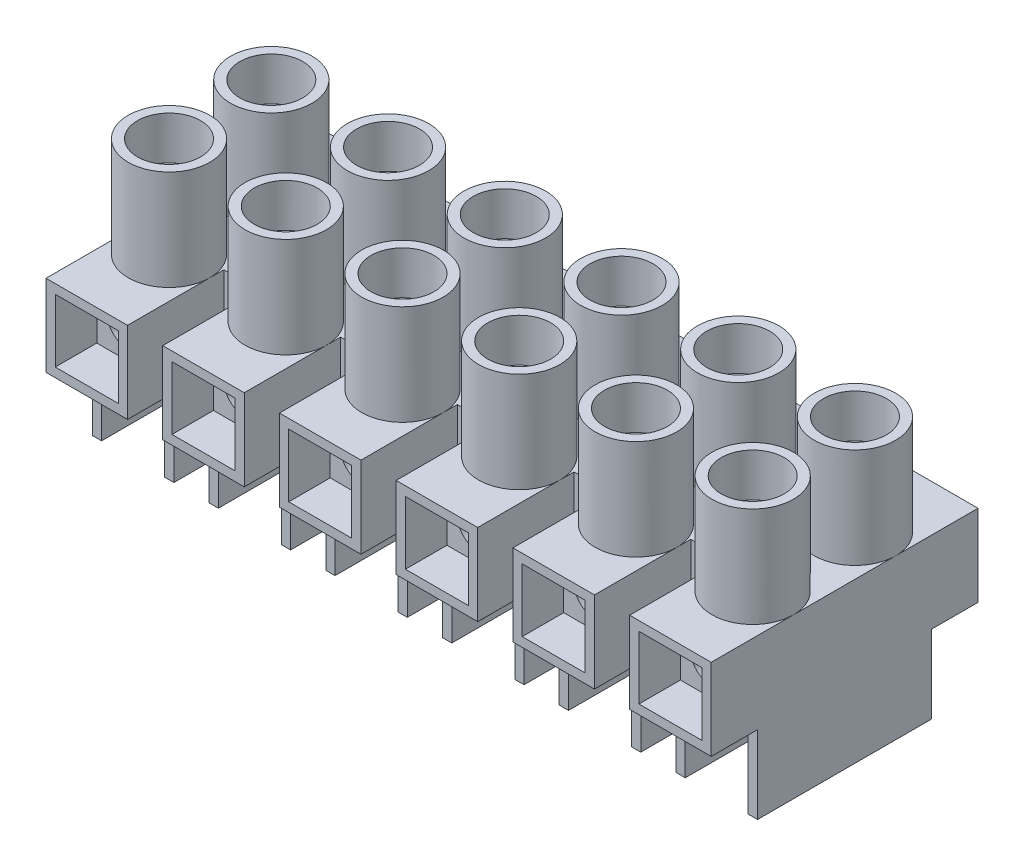
from build123d import *

# Parameters (mm, degrees)
SKETCH1_W           = 5.588
SKETCH1_H           = 5.588
BOSS_EXTRUDE1_DEPTH = 9.144
SKETCH2_R           = 2.794
BOSS_EXTRUDE2_DEPTH = 6.858
SHELL1_START        = 0.635
SHELL1_OUTLINE_R    = 2.159
SHELL1_DEPTH        = 11.811
SHELL1_2_DEPTH      = 4.318
SKETCH3_W           = 5.588
SKETCH3_H           = 5.969
BOSS_EXTRUDE3_DEPTH = 5.334
SHELL2_START        = -5.334
SHELL2_OUTLINE_W    = 4.318
SHELL2_OUTLINE_H    = 5.969
SHELL2_DEPTH        = 5.334
LPATTERN1_COUNT     = 6
LPATTERN1_PITCH     = 8.001
SKETCH5_W           = 2.413
SKETCH5_H           = 2.54
BOSS_EXTRUDE4_DEPTH = 5.588
CUT_EXTRUDE1_START  = -49.137691064
SKETCH7_R           = 1.4986
CUT_EXTRUDE1_DEPTH  = 54.725691064
LPATTERN2_COUNT     = 5
LPATTERN2_PITCH     = 8.001
LPATTERN2_2_COUNT   = 5
LPATTERN2_2_PITCH   = 8.001
SKETCH8_W           = 4.2164
SKETCH8_H           = 4.2164
SKETCH8_R           = 1.397
BOSS_EXTRUDE5_DEPTH = 6.35
LPATTERN3_COUNT     = 6
LPATTERN3_PITCH     = 8.001
SKETCH9_R           = 1.5875
BOSS_EXTRUDE6_DEPTH = 1.524
BOSS_EXTRUDE6_DRAFT = -15
SKETCH10_W          = 3.991709138
SKETCH10_H          = 0.508
CUT_EXTRUDE2_DEPTH  = 0.508
SKETCH11_R          = 1.143
BOSS_EXTRUDE7_DEPTH = 3.81
LPATTERN4_COUNT     = 6
LPATTERN4_PITCH     = 8.001
LPATTERN4_2_COUNT   = 2
LPATTERN4_2_PITCH   = 7.0104


# Read off the part's stored shape, not the designer's step: Shell1, Shell2
with BuildPart() as part:
    # Sketch1 → Boss-Extrude1 (new body)
    with BuildSketch(Plane.XY):
        with Locations((2.794, 2.794)):
            Rectangle(SKETCH1_W, SKETCH1_H)
    extrude(amount=BOSS_EXTRUDE1_DEPTH)

    # Sketch2 → Boss-Extrude2 (add)
    with BuildSketch(Plane(origin=(0, 5.588, 0), x_dir=(1, 0, 0), z_dir=(0, 1, 0))):
        with Locations(Location((2.794, -3.5052, 0), (0, 0, 180))):
            Circle(SKETCH2_R)
    extrude(amount=BOSS_EXTRUDE2_DEPTH)

    # Shell1 outline → Shell1 (cut)
    with BuildSketch(Plane(origin=(0, 0, 0), x_dir=(1, 0, 0), z_dir=(0, 1, 0)).offset(SHELL1_START)):
        with Locations((2.794, -3.5052)):
            Circle(SHELL1_OUTLINE_R)
    extrude(amount=SHELL1_DEPTH, mode=Mode.SUBTRACT)

    # Shell1 2 outline → Shell1 2 (cut)
    with BuildSketch(Plane(origin=(0, 0, 0), x_dir=(1, 0, 0), z_dir=(0, 1, 0)).offset(SHELL1_START)):
        with BuildLine():
            Line((0.635, -3.5052), (0.635, -9.144))
            Line((0.635, -9.144), (4.953, -9.144))
            Line((4.953, -9.144), (4.953, -3.5052))
            ThreePointArc((4.953, -3.5052), (2.794, -5.6642), (0.635, -3.5052))
        make_face()
        with BuildLine():
            Line((0.635, 0), (0.635, -3.5052))
            ThreePointArc((0.635, -3.5052), (2.794, -1.3462), (4.953, -3.5052))
            Line((4.953, -3.5052), (4.953, 0))
            Line((4.953, 0), (0.635, 0))
        make_face()
    extrude(amount=SHELL1_2_DEPTH, mode=Mode.SUBTRACT)

    # Sketch3 → Boss-Extrude3 (add)
    with BuildSketch(Plane.XZ):
        with Locations((2.794, 2.9845)):
            Rectangle(SKETCH3_W, SKETCH3_H)
    extrude(amount=BOSS_EXTRUDE3_DEPTH)

    # Shell2 outline → Shell2 (cut)
    with BuildSketch(Plane(origin=(0, 0, 0), x_dir=(1, 0, 0), z_dir=(0, 1, 0)).offset(SHELL2_START)):
        with Locations((2.794, -2.9845)):
            Rectangle(SHELL2_OUTLINE_W, SHELL2_OUTLINE_H)
    extrude(amount=SHELL2_DEPTH, mode=Mode.SUBTRACT)


with BuildPart() as lpattern1_1:
    # LPattern1: pattern copy
    add(part.part.moved(Location(Vector(1, 0, 0) * (1 * LPATTERN1_PITCH))))


with BuildPart() as lpattern1_2:
    # LPattern1: pattern copy
    add(part.part.moved(Location(Vector(1, 0, 0) * (2 * LPATTERN1_PITCH))))


with BuildPart() as lpattern1_3:
    # LPattern1: pattern copy
    add(part.part.moved(Location(Vector(1, 0, 0) * (3 * LPATTERN1_PITCH))))


with BuildPart() as lpattern1_4:
    # LPattern1: pattern copy
    add(part.part.moved(Location(Vector(1, 0, 0) * (4 * LPATTERN1_PITCH))))


with BuildPart() as lpattern1_5:
    # LPattern1: pattern copy
    add(part.part.moved(Location(Vector(1, 0, 0) * (5 * LPATTERN1_PITCH))))


with BuildPart() as part_1:
    add(part.part)

    add(lpattern1_1.part)  # Boss-Extrude4 merges LPattern1_1
    # Sketch5 → Boss-Extrude4 (add)
    with BuildSketch(Plane(origin=(0, 0, 0), x_dir=(1, 0, 0), z_dir=(0, 1, 0))):
        with Locations((6.7945, -1.27)):
            Rectangle(SKETCH5_W, SKETCH5_H)
    boss_extrude4 = extrude(amount=BOSS_EXTRUDE4_DEPTH)

    # Sketch7 → Cut-Extrude1 (cut)
    with BuildSketch(Plane(origin=(0, 0, 0), x_dir=(1, 0, 0), z_dir=(0, 1, 0)).offset(CUT_EXTRUDE1_START)):
        with Locations((6.7945, 0)):
            Circle(SKETCH7_R)
    cut_extrude1 = extrude(amount=CUT_EXTRUDE1_DEPTH, mode=Mode.SUBTRACT)

    add(lpattern1_2.part)  # LPattern2 merges LPattern1_2

    add(lpattern1_3.part)  # LPattern2 merges LPattern1_3

    add(lpattern1_4.part)  # LPattern2 merges LPattern1_4

    add(lpattern1_5.part)  # LPattern2 merges LPattern1_5
    # LPattern2: Boss-Extrude4 ×5
    with Locations(*[(i * LPATTERN2_PITCH, 0, 0) for i in range(1, LPATTERN2_COUNT)]):
        add(boss_extrude4)

    # LPattern2 2: Cut-Extrude1 ×5
    with Locations(*[(i * LPATTERN2_2_PITCH, 0, 0) for i in range(1, LPATTERN2_2_COUNT)]):
        add(cut_extrude1, mode=Mode.SUBTRACT)

    # Mirror1: part across plane


with BuildPart() as part_2:
    add(part_1.part)
    add(part_1.part.mirror(Plane.XY))


with BuildPart() as body_2:
    # Sketch8 → Boss-Extrude5 (new body)
    with BuildSketch(Plane.XY):
        with Locations((2.794, 2.794)):
            Rectangle(SKETCH8_W, SKETCH8_H)
        with Locations((2.794, 2.794)):
            Circle(SKETCH8_R, mode=Mode.SUBTRACT)
    extrude(amount=BOSS_EXTRUDE5_DEPTH)

    # Mirror2: body 2 across plane


with BuildPart() as body_2_1:
    add(body_2.part)
    add(body_2.part.mirror(Plane.XY))


with BuildPart() as lpattern3_1:
    # LPattern3: pattern copy
    add(body_2_1.part.moved(Location(Vector(1, 0, 0) * (1 * LPATTERN3_PITCH))))


with BuildPart() as lpattern3_2:
    # LPattern3: pattern copy
    add(body_2_1.part.moved(Location(Vector(1, 0, 0) * (2 * LPATTERN3_PITCH))))


with BuildPart() as lpattern3_3:
    # LPattern3: pattern copy
    add(body_2_1.part.moved(Location(Vector(1, 0, 0) * (3 * LPATTERN3_PITCH))))


with BuildPart() as lpattern3_4:
    # LPattern3: pattern copy
    add(body_2_1.part.moved(Location(Vector(1, 0, 0) * (4 * LPATTERN3_PITCH))))


with BuildPart() as lpattern3_5:
    # LPattern3: pattern copy
    add(body_2_1.part.moved(Location(Vector(1, 0, 0) * (5 * LPATTERN3_PITCH))))


with BuildPart() as body_8:
    # Sketch9 → Boss-Extrude6 (with draft: the straight prism first)
    with BuildSketch(Plane(origin=(0, 8.0772, 0), x_dir=(1, 0, 0), z_dir=(0, 1, 0))):
        with Locations((2.794, -3.5052)):
            Circle(SKETCH9_R)
    extrude(amount=BOSS_EXTRUDE6_DEPTH)
    # Boss-Extrude6: the draft: its side faces are tilted about the plane it starts from
    boss_extrude6_sides = [body_8.faces().sort_by_distance(p)[0] for p in [
        (1.2065, 8.8392, 3.5052),
    ]]
    draft(boss_extrude6_sides, Plane(origin=(0, 8.0772, 0), x_dir=(1, 0, 0), z_dir=(0, 1, 0)), BOSS_EXTRUDE6_DRAFT)

    # Sketch10 → Cut-Extrude2 (cut)
    with BuildSketch(Plane(origin=(0, 9.6012, 0), x_dir=(1, 0, 0), z_dir=(0, 1, 0))):
        with Locations((2.794, -3.5052)):
            Rectangle(SKETCH10_W, SKETCH10_H)
    extrude(amount=-CUT_EXTRUDE2_DEPTH, mode=Mode.SUBTRACT)

    # Sketch11 → Boss-Extrude7 (add)
    with BuildSketch(Plane.XZ.offset(-8.0772)):
        with Locations(Location((2.794, 3.5052, 0), (0, 0, 90))):
            Circle(SKETCH11_R)
    extrude(amount=BOSS_EXTRUDE7_DEPTH)


with BuildPart() as lpattern4_1:
    # LPattern4: pattern copy
    add(body_8.part.moved(Location(Vector(1, 0, 0) * (1 * LPATTERN4_PITCH))))


with BuildPart() as lpattern4_2:
    # LPattern4: pattern copy
    add(body_8.part.moved(Location(Vector(1, 0, 0) * (2 * LPATTERN4_PITCH))))


with BuildPart() as lpattern4_3:
    # LPattern4: pattern copy
    add(body_8.part.moved(Location(Vector(1, 0, 0) * (3 * LPATTERN4_PITCH))))


with BuildPart() as lpattern4_4:
    # LPattern4: pattern copy
    add(body_8.part.moved(Location(Vector(1, 0, 0) * (4 * LPATTERN4_PITCH))))


with BuildPart() as lpattern4_5:
    # LPattern4: pattern copy
    add(body_8.part.moved(Location(Vector(1, 0, 0) * (5 * LPATTERN4_PITCH))))


with BuildPart() as lpattern4_2_1:
    # LPattern4 2: pattern copy
    add(body_8.part.moved(Location(Vector(0, 0, -1) * (1 * LPATTERN4_2_PITCH))))


with BuildPart() as lpattern4_2_2:
    # LPattern4 2: pattern copy
    add(lpattern4_1.part.moved(Location(Vector(0, 0, -1) * (1 * LPATTERN4_2_PITCH))))


with BuildPart() as lpattern4_2_3:
    # LPattern4 2: pattern copy
    add(lpattern4_2.part.moved(Location(Vector(0, 0, -1) * (1 * LPATTERN4_2_PITCH))))


with BuildPart() as lpattern4_2_4:
    # LPattern4 2: pattern copy
    add(lpattern4_3.part.moved(Location(Vector(0, 0, -1) * (1 * LPATTERN4_2_PITCH))))


with BuildPart() as lpattern4_2_5:
    # LPattern4 2: pattern copy
    add(lpattern4_4.part.moved(Location(Vector(0, 0, -1) * (1 * LPATTERN4_2_PITCH))))


with BuildPart() as lpattern4_2_6:
    # LPattern4 2: pattern copy
    add(lpattern4_5.part.moved(Location(Vector(0, 0, -1) * (1 * LPATTERN4_2_PITCH))))


solid = Compound([part_2.part, body_2_1.part, lpattern3_1.part, lpattern3_2.part, lpattern3_3.part, lpattern3_4.part, lpattern3_5.part, body_8.part, lpattern4_1.part, lpattern4_2.part, lpattern4_3.part, lpattern4_4.part, lpattern4_5.part, lpattern4_2_1.part, lpattern4_2_2.part, lpattern4_2_3.part, lpattern4_2_4.part, lpattern4_2_5.part, lpattern4_2_6.part])
